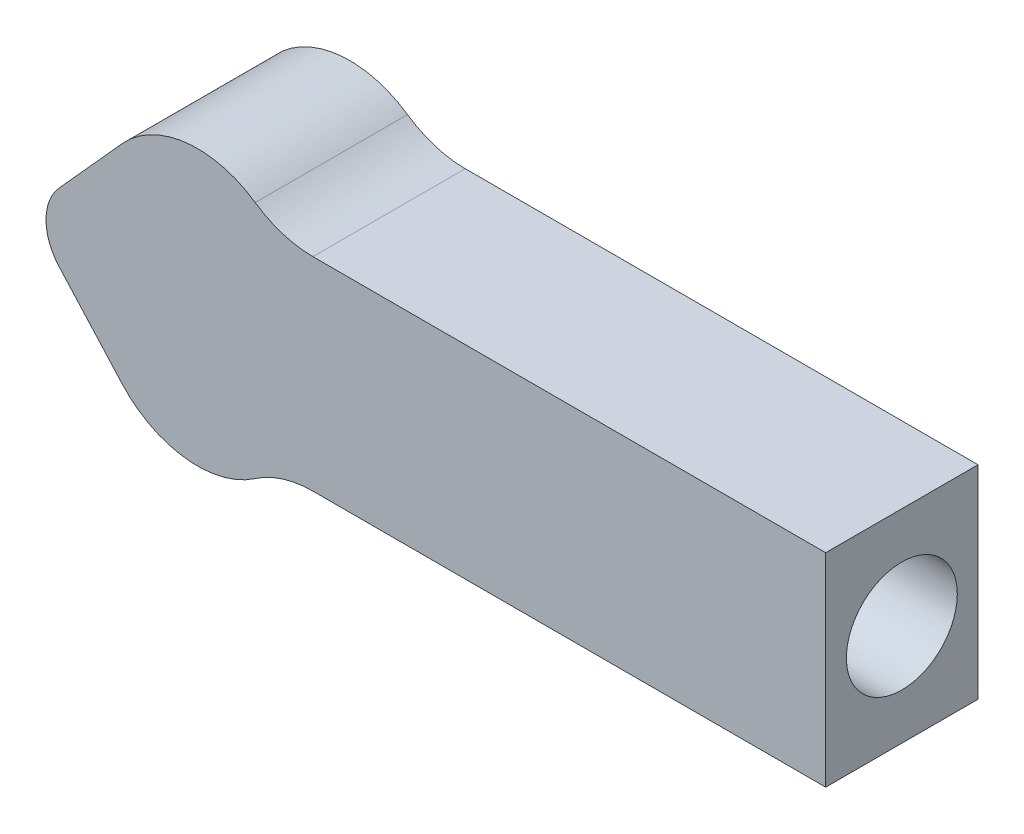
from build123d import *

# Parameters (mm, degrees)
BOSS_EXTRUDE1_DEPTH     = 3
FILLET2_R               = 2
FILLET3_R               = 2
M1_6_TAPPED_HOLE1_D     = 1.25
M1_6_TAPPED_HOLE1_DEPTH = 3
M1_6_TAPPED_HOLE1_TIP   = 0.375537887
SKETCH5_R               = 1.0922
CUT_EXTRUDE1_DEPTH      = 3


with BuildPart() as part:
    # Sketch1 → Boss-Extrude1 (new body)
    with BuildSketch(Plane.XY):
        with BuildLine():
            Line((-3.05, 2), (-3.05, 4))
            Line((-3.05, 4), (-6.05, 0.669251394))
            ThreePointArc((-6.05, 0.669251394), (-6.30696395, 0), (-6.05, -0.669251394))
            Line((-6.05, -0.669251394), (-3.05, -4))
            Line((-3.05, -4), (-3.05, -2))
            Line((-3.05, -2), (3.05, -2))
            Line((3.05, -2), (9.05, -2))
            Line((9.05, -2), (9.05, 2))
            Line((9.05, 2), (3.05, 2))
            Line((3.05, 2), (-3.05, 2))
        make_face()
    extrude(amount=BOSS_EXTRUDE1_DEPTH)

    # Fillet2
    fillet2_edges = [part.edges().sort_by_distance(p)[0] for p in [
        (-3.05, -2, 1.5),
        (-3.05, 2, 1.5),
    ]]
    fillet(fillet2_edges, radius=FILLET2_R - 0.0001)  # a hair under: the kernel refuses the full size

    # Fillet3
    fillet3_edges = [part.edges().sort_by_distance(p)[0] for p in [
        (-3.05, 4, 1.5),
        (-3.05, -4, 1.5),
    ]]
    fillet(fillet3_edges, radius=FILLET3_R)

    # M1.6 Tapped Hole1
    with Locations(Plane(origin=(9.05, 0, 0), x_dir=(0, 0, -1), z_dir=(1, 0, 0))):
        with Locations((-1.5, 0)):
            Hole(M1_6_TAPPED_HOLE1_D / 2, depth=M1_6_TAPPED_HOLE1_DEPTH)
            with Locations((0, 0, -(M1_6_TAPPED_HOLE1_DEPTH + M1_6_TAPPED_HOLE1_TIP / 2))):  # 118° drill point
                Cone(0, M1_6_TAPPED_HOLE1_D / 2, M1_6_TAPPED_HOLE1_TIP, mode=Mode.SUBTRACT)

    # Sketch5 → Cut-Extrude1 (cut)
    with BuildSketch(Plane(origin=(9.05, 0, 0), x_dir=(0, 0, -1), z_dir=(1, 0, 0))):
        with Locations((-1.5, 0)):
            Circle(SKETCH5_R)
    extrude(amount=-CUT_EXTRUDE1_DEPTH, mode=Mode.SUBTRACT)


solid = part.part
